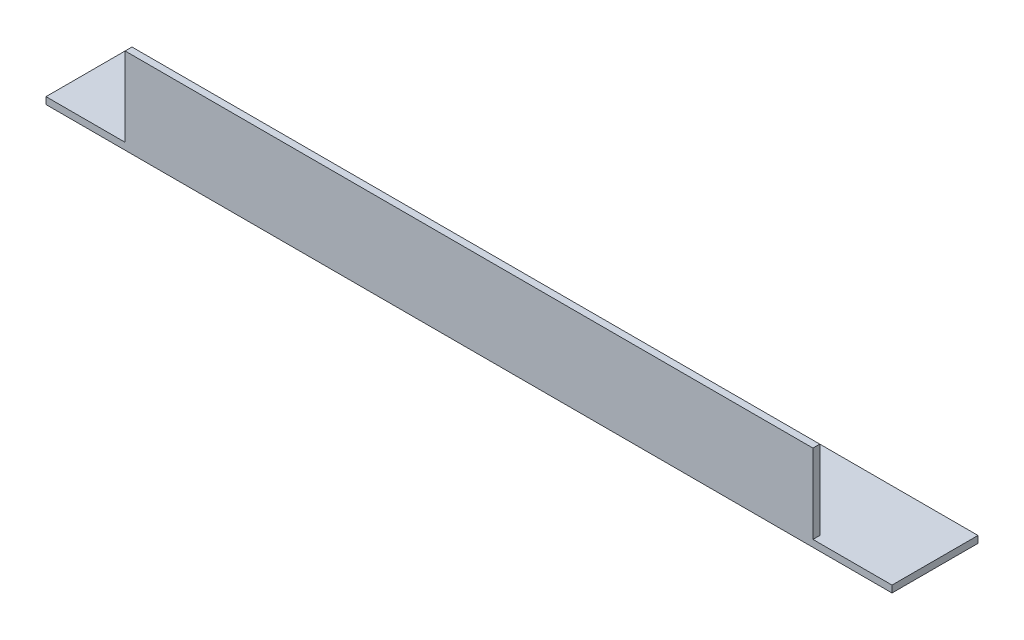
from build123d import *

# Parameters (mm, degrees)
EXTRUDE_1_DEPTH     = 246
SKETCH_2_W          = 23
SKETCH_2_H          = 23
CUT_EXTRUDE_1_DEPTH = 249.527664456


with BuildPart() as part:
    # Эскиз1 → Вытянуть-Тонкостенный1 (new body)
    with BuildSketch(Plane(origin=(0, 0, 0), x_dir=(0, 0, -1), z_dir=(1, 0, 0))):
        Polygon((0, 25), (0, 0), (25, 0), (25, 2), (2, 2), (2, 25), align=None)
    extrude(amount=EXTRUDE_1_DEPTH)

    # Эскиз2 → Вырез-Вытянуть1 (cut, through all)
    with BuildSketch(Plane.XY):
        with Locations((234.5, 13.5)):
            Rectangle(SKETCH_2_W, SKETCH_2_H)
        with Locations((11.5, 13.5)):
            Rectangle(SKETCH_2_W, SKETCH_2_H)
    extrude(amount=-CUT_EXTRUDE_1_DEPTH, mode=Mode.SUBTRACT)


solid = part.part
